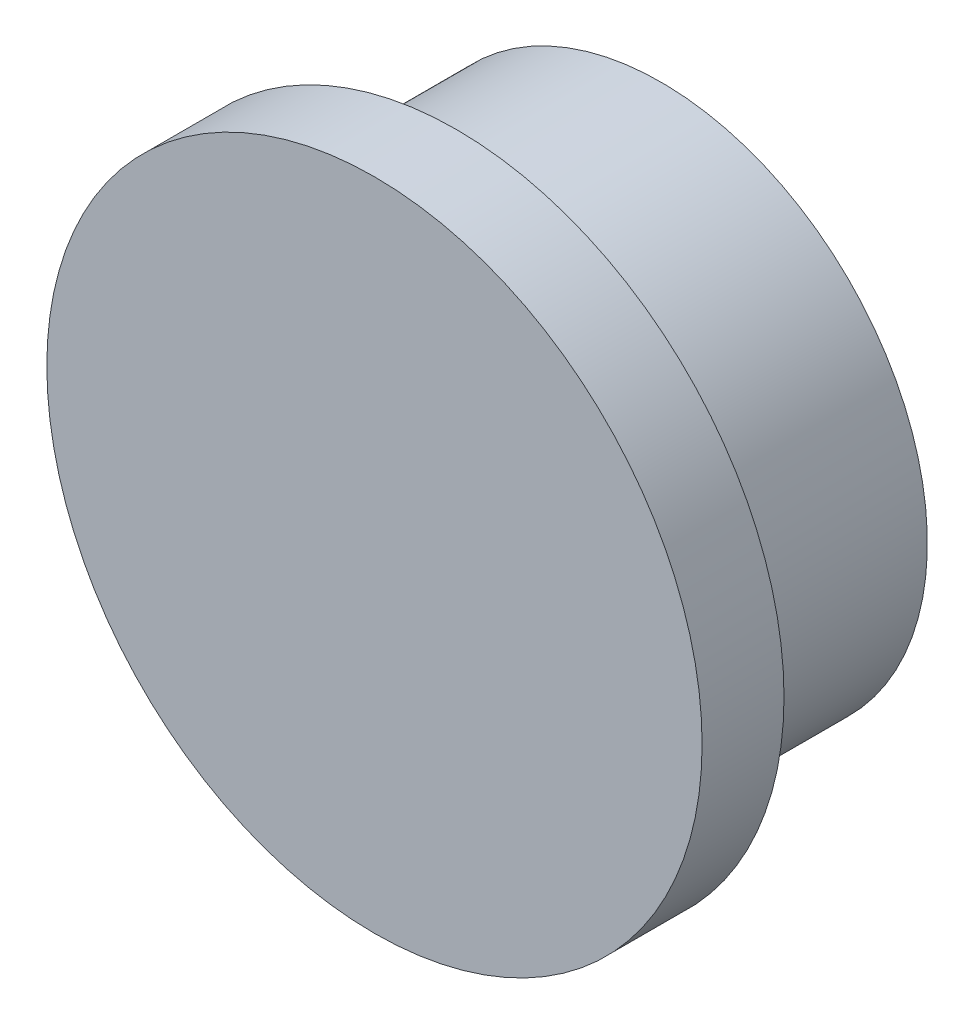
from build123d import *

# Parameters (mm, degrees)
SKETCH1_R           = 12
BOSS_EXTRUDE1_DEPTH = 3
SKETCH2_R           = 9.75
BOSS_EXTRUDE2_DEPTH = 7.5
SKETCH3_R           = 2.35
CUT_EXTRUDE1_DEPTH  = 5


with BuildPart() as part:
    # Sketch1 → Boss-Extrude1 (new body)
    with BuildSketch(Plane.XY):
        with Locations((-127.992538975, 40.103259291)):
            Circle(SKETCH1_R)
    extrude(amount=BOSS_EXTRUDE1_DEPTH)

    # Sketch2 → Boss-Extrude2 (add)
    with BuildSketch(Plane(origin=(0, 0, 0), x_dir=(-1, 0, 0), z_dir=(0, 0, -1))):
        with Locations((127.992538975, 40.103259291)):
            Circle(SKETCH2_R)
    extrude(amount=BOSS_EXTRUDE2_DEPTH)

    # Sketch3 → Cut-Extrude1 (cut)
    with BuildSketch(Plane(origin=(0, 0, -7.5), x_dir=(-1, 0, 0), z_dir=(0, 0, -1))):
        with Locations((127.992538975, 40.103259291)):
            Circle(SKETCH3_R)
    extrude(amount=-CUT_EXTRUDE1_DEPTH, mode=Mode.SUBTRACT)


solid = part.part
